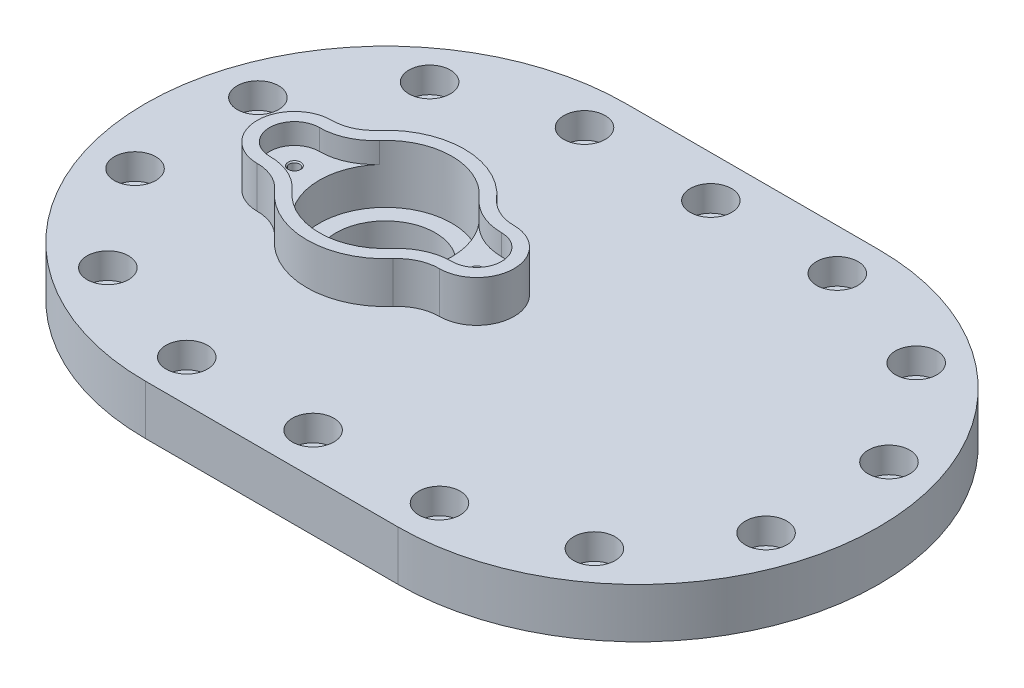
from build123d import *

# Parameters (mm, degrees)
SKETCH2_R                   = 5
BOSS_EXTRUDE4_DEPTH         = 12
SKETCH2_6_R                 = 16
SKETCH2_6_R_2               = 12
BOSS_EXTRUDE5_DEPTH         = 8
SKETCH2_7_R                 = 1.25
BOSS_EXTRUDE6_DEPTH         = 17
BOSS_EXTRUDE7_DEPTH         = 22
SKETCH2_10_R                = 1.25
BOSS_EXTRUDE9_DEPTH         = 17
M3_TAPPED_HOLE2_D           = 2.5
M3_TAPPED_HOLE2_DEPTH       = 10
M3_TAPPED_HOLE2_CSINK_D     = 3.05
M3_TAPPED_HOLE2_CSINK_ANGLE = 90
M3_TAPPED_HOLE2_TIP         = 0.751075774
SKETCH11_R                  = 12
CUT_EXTRUDE1_DEPTH          = 1
SKETCH12_R                  = 8
CUT_EXTRUDE2_DEPTH          = 6
CHAMFER1_SIZE               = 1
SKETCH2_12_R                = 5
SKETCH2_12_R_2              = 2.75
BOSS_EXTRUDE10_DEPTH        = 5.8


with BuildPart() as part:
    # Sketch2 → Boss-Extrude4 (new body)
    with BuildSketch(Plane(origin=(0, 0, 0), x_dir=(1, 0, 0), z_dir=(0, 1, 0))):
        with BuildLine():
            Line((-61, -58), (0, -58))
            ThreePointArc((0, -58), (58, 0), (0, 58))
            Line((0, 58), (-61, 58))
            ThreePointArc((-61, 58), (-119, 0), (-61, -58))
        make_face()
        with Locations(Location((0, 48, 0), (0, 0, 270))):
            Circle(SKETCH2_R, mode=Mode.SUBTRACT)
        with Locations(Location((-30.5, 48, 0), (0, 0, 270))):
            Circle(SKETCH2_R, mode=Mode.SUBTRACT)
        with Locations(Location((-61, 48, 0), (0, 0, 270))):
            Circle(SKETCH2_R, mode=Mode.SUBTRACT)
        with Locations(Location((-89.21369211, 38.83281573, 0), (0, 0, 270))):
            Circle(SKETCH2_R, mode=Mode.SUBTRACT)
        with Locations(Location((-106.650712782, 14.83281573, 0), (0, 0, 270))):
            Circle(SKETCH2_R, mode=Mode.SUBTRACT)
        with Locations(Location((-106.650712782, -14.83281573, 0), (0, 0, 270))):
            Circle(SKETCH2_R, mode=Mode.SUBTRACT)
        with Locations(Location((-89.21369211, -38.83281573, 0), (0, 0, 270))):
            Circle(SKETCH2_R, mode=Mode.SUBTRACT)
        with Locations(Location((-61, -48, 0), (0, 0, 270))):
            Circle(SKETCH2_R, mode=Mode.SUBTRACT)
        with Locations(Location((-30.5, -48, 0), (0, 0, 270))):
            Circle(SKETCH2_R, mode=Mode.SUBTRACT)
        with Locations(Location((0, -48, 0), (0, 0, 270))):
            Circle(SKETCH2_R, mode=Mode.SUBTRACT)
        with Locations(Location((28.21369211, -38.83281573, 0), (0, 0, 270))):
            Circle(SKETCH2_R, mode=Mode.SUBTRACT)
        with Locations(Location((45.650712782, -14.83281573, 0), (0, 0, 270))):
            Circle(SKETCH2_R, mode=Mode.SUBTRACT)
        with Locations(Location((45.650712782, 14.83281573, 0), (0, 0, 270))):
            Circle(SKETCH2_R, mode=Mode.SUBTRACT)
        with Locations(Location((28.21369211, 38.83281573, 0), (0, 0, 270))):
            Circle(SKETCH2_R, mode=Mode.SUBTRACT)
        with BuildLine():
            ThreePointArc((-75.315068493, -12.493150685), (-61, -19), (-46.684931507, -12.493150685))
            ThreePointArc((-46.684931507, -12.493150685), (-43.220790032, -9.91426193), (-39, -9))
            ThreePointArc((-39, -9), (-30, 0), (-39, 9))
            ThreePointArc((-39, 9), (-43.220790032, 9.91426193), (-46.684931507, 12.493150685))
            ThreePointArc((-46.684931507, 12.493150685), (-61, 19), (-75.315068493, 12.493150685))
            ThreePointArc((-75.315068493, 12.493150685), (-78.779209968, 9.91426193), (-83, 9))
            ThreePointArc((-83, 9), (-92, 0), (-83, -9))
            ThreePointArc((-83, -9), (-78.779209968, -9.91426193), (-75.315068493, -12.493150685))
        make_face(mode=Mode.SUBTRACT)
    extrude(amount=BOSS_EXTRUDE4_DEPTH)



with BuildPart() as body_2:
    # Sketch2<6> → Boss-Extrude5 (new body)
    with BuildSketch(Plane(origin=(0, 0, 0), x_dir=(1, 0, 0), z_dir=(0, 1, 0))):
        with Locations(Location((-61, 0, 0), (0, 0, 270))):
            Circle(SKETCH2_6_R)
        with Locations(Location((-61, 0, 0), (0, 0, 270))):
            Circle(SKETCH2_6_R_2, mode=Mode.SUBTRACT)
    extrude(amount=BOSS_EXTRUDE5_DEPTH)

    # Sketch2<7> → Boss-Extrude6 (add)
    # profile 1 of 2: a face of its own
    with BuildSketch(Plane(origin=(0, 0, 0), x_dir=(1, 0, 0), z_dir=(0, 1, 0))):
        with BuildLine():
            ThreePointArc((-48.945205479, 10.520547945), (-46.018733159, 5.617975065), (-45, 0))
            ThreePointArc((-45, 0), (-46.018733159, -5.617975065), (-48.945205479, -10.520547945))
            ThreePointArc((-48.945205479, -10.520547945), (-44.462198865, -7.183162497), (-39, -6))
            ThreePointArc((-39, -6), (-33, 0), (-39, 6))
            ThreePointArc((-39, 6), (-44.462198865, 7.183162497), (-48.945205479, 10.520547945))
        make_face()
        with Locations(Location((-39, 0, 0), (0, 0, 270))):
            Circle(SKETCH2_7_R, mode=Mode.SUBTRACT)
    # profile 2 of 2: a face of its own
    with BuildSketch(Plane(origin=(0, 0, 0), x_dir=(1, 0, 0), z_dir=(0, 1, 0))):
        with BuildLine():
            ThreePointArc((-73.054794521, -10.520547945), (-77, 0), (-73.054794521, 10.520547945))
            ThreePointArc((-73.054794521, 10.520547945), (-77.537801135, 7.183162497), (-83, 6))
            ThreePointArc((-83, 6), (-89, 0), (-83, -6))
            ThreePointArc((-83, -6), (-77.537801135, -7.183162497), (-73.054794521, -10.520547945))
        make_face()
        with Locations(Location((-83, 0, 0), (0, 0, 270))):
            Circle(SKETCH2_7_R, mode=Mode.SUBTRACT)
    extrude(amount=BOSS_EXTRUDE6_DEPTH)


with BuildPart() as part_1:
    add(part.part)

    add(body_2.part)  # Boss-Extrude7 merges body 2
    # Sketch2<8> → Boss-Extrude7 (add)
    with BuildSketch(Plane(origin=(0, 0, 0), x_dir=(1, 0, 0), z_dir=(0, 1, 0))):
        with BuildLine():
            ThreePointArc((-46.684931507, -12.493150685), (-43.220790032, -9.91426193), (-39, -9))
            ThreePointArc((-39, -9), (-30, 0), (-39, 9))
            ThreePointArc((-39, 9), (-43.220790032, 9.91426193), (-46.684931507, 12.493150685))
            ThreePointArc((-46.684931507, 12.493150685), (-61, 19), (-75.315068493, 12.493150685))
            ThreePointArc((-75.315068493, 12.493150685), (-78.779209968, 9.91426193), (-83, 9))
            ThreePointArc((-83, 9), (-92, 0), (-83, -9))
            ThreePointArc((-83, -9), (-78.779209968, -9.91426193), (-75.315068493, -12.493150685))
            ThreePointArc((-75.315068493, -12.493150685), (-61, -19), (-46.684931507, -12.493150685))
        make_face()
        with BuildLine():
            ThreePointArc((-48.945205479, 10.520547945), (-44.462198865, 7.183162497), (-39, 6))
            ThreePointArc((-39, 6), (-33, 0), (-39, -6))
            ThreePointArc((-39, -6), (-44.462198865, -7.183162497), (-48.945205479, -10.520547945))
            ThreePointArc((-48.945205479, -10.520547945), (-61, -16), (-73.054794521, -10.520547945))
            ThreePointArc((-73.054794521, -10.520547945), (-77.537801135, -7.183162497), (-83, -6))
            ThreePointArc((-83, -6), (-89, 0), (-83, 6))
            ThreePointArc((-83, 6), (-77.537801135, 7.183162497), (-73.054794521, 10.520547945))
            ThreePointArc((-73.054794521, 10.520547945), (-61, 16), (-48.945205479, 10.520547945))
        make_face(mode=Mode.SUBTRACT)
    extrude(amount=BOSS_EXTRUDE7_DEPTH)

    # Sketch2<10> → Boss-Extrude9 (add)
    with BuildSketch(Plane(origin=(0, 0, 0), x_dir=(1, 0, 0), z_dir=(0, 1, 0))):
        with Locations((-39, 0)):
            Circle(SKETCH2_10_R)
        with Locations((-83, 0)):
            Circle(SKETCH2_10_R)
    extrude(amount=BOSS_EXTRUDE9_DEPTH)

    # M3 Tapped Hole2
    with Locations(Plane(origin=(0, 17, 0), x_dir=(1, 0, 0), z_dir=(0, 1, 0))):
        with Locations((-39, 0), (-83, 0)):
            CounterSinkHole(M3_TAPPED_HOLE2_D / 2, M3_TAPPED_HOLE2_CSINK_D / 2, depth=M3_TAPPED_HOLE2_DEPTH, counter_sink_angle=M3_TAPPED_HOLE2_CSINK_ANGLE)
            with Locations((0, 0, -(M3_TAPPED_HOLE2_DEPTH + M3_TAPPED_HOLE2_TIP / 2))):  # 118° drill point
                Cone(0, M3_TAPPED_HOLE2_D / 2, M3_TAPPED_HOLE2_TIP, mode=Mode.SUBTRACT)

    # Sketch11 → Cut-Extrude1 (cut)
    with BuildSketch(Plane.XZ):
        with Locations(Location((0, 0, 0), (0, 0, 270))):
            Circle(SKETCH11_R)
    extrude(amount=-CUT_EXTRUDE1_DEPTH, mode=Mode.SUBTRACT)

    # Sketch12 → Cut-Extrude2 (cut)
    with BuildSketch(Plane.XZ):
        with Locations(Location((0, 0, 0), (0, 0, 270))):
            Circle(SKETCH12_R)
    extrude(amount=-CUT_EXTRUDE2_DEPTH, mode=Mode.SUBTRACT)

    # Chamfer1
    chamfer1_edges = [part_1.edges().sort_by_distance(p)[0] for p in [
        (0, 0, 12),
    ]]
    chamfer(chamfer1_edges, length=CHAMFER1_SIZE - 0.0001)  # a hair under: the kernel refuses the full size

    # Sketch2<12> → Boss-Extrude10 (add)
    # profile 1 of 14: a face of its own
    with BuildSketch(Plane(origin=(0, 0, 0), x_dir=(1, 0, 0), z_dir=(0, 1, 0))):
        with Locations(Location((0, -48, 0), (0, 0, 270))):
            Circle(SKETCH2_12_R)
        with Locations(Location((0, -48, 0), (0, 0, 270))):
            Circle(SKETCH2_12_R_2, mode=Mode.SUBTRACT)
    # profile 2 of 14: a face of its own
    with BuildSketch(Plane(origin=(0, 0, 0), x_dir=(1, 0, 0), z_dir=(0, 1, 0))):
        with Locations(Location((28.21369211, -38.83281573, 0), (0, 0, 270))):
            Circle(SKETCH2_12_R)
        with Locations(Location((28.21369211, -38.83281573, 0), (0, 0, 270))):
            Circle(SKETCH2_12_R_2, mode=Mode.SUBTRACT)
    # profile 3 of 14: a face of its own
    with BuildSketch(Plane(origin=(0, 0, 0), x_dir=(1, 0, 0), z_dir=(0, 1, 0))):
        with Locations(Location((45.650712782, -14.83281573, 0), (0, 0, 270))):
            Circle(SKETCH2_12_R)
        with Locations(Location((45.650712782, -14.83281573, 0), (0, 0, 270))):
            Circle(SKETCH2_12_R_2, mode=Mode.SUBTRACT)
    # profile 4 of 14: a face of its own
    with BuildSketch(Plane(origin=(0, 0, 0), x_dir=(1, 0, 0), z_dir=(0, 1, 0))):
        with Locations(Location((45.650712782, 14.83281573, 0), (0, 0, 270))):
            Circle(SKETCH2_12_R)
        with Locations(Location((45.650712782, 14.83281573, 0), (0, 0, 270))):
            Circle(SKETCH2_12_R_2, mode=Mode.SUBTRACT)
    # profile 5 of 14: a face of its own
    with BuildSketch(Plane(origin=(0, 0, 0), x_dir=(1, 0, 0), z_dir=(0, 1, 0))):
        with Locations(Location((28.21369211, 38.83281573, 0), (0, 0, 270))):
            Circle(SKETCH2_12_R)
        with Locations(Location((28.21369211, 38.83281573, 0), (0, 0, 270))):
            Circle(SKETCH2_12_R_2, mode=Mode.SUBTRACT)
    # profile 6 of 14: a face of its own
    with BuildSketch(Plane(origin=(0, 0, 0), x_dir=(1, 0, 0), z_dir=(0, 1, 0))):
        with Locations(Location((0, 48, 0), (0, 0, 270))):
            Circle(SKETCH2_12_R)
        with Locations(Location((0, 48, 0), (0, 0, 270))):
            Circle(SKETCH2_12_R_2, mode=Mode.SUBTRACT)
    # profile 7 of 14: a face of its own
    with BuildSketch(Plane(origin=(0, 0, 0), x_dir=(1, 0, 0), z_dir=(0, 1, 0))):
        with Locations(Location((-30.5, 48, 0), (0, 0, 270))):
            Circle(SKETCH2_12_R)
        with Locations(Location((-30.5, 48, 0), (0, 0, 270))):
            Circle(SKETCH2_12_R_2, mode=Mode.SUBTRACT)
    # profile 8 of 14: a face of its own
    with BuildSketch(Plane(origin=(0, 0, 0), x_dir=(1, 0, 0), z_dir=(0, 1, 0))):
        with Locations(Location((-61, 48, 0), (0, 0, 270))):
            Circle(SKETCH2_12_R)
        with Locations(Location((-61, 48, 0), (0, 0, 270))):
            Circle(SKETCH2_12_R_2, mode=Mode.SUBTRACT)
    # profile 9 of 14: a face of its own
    with BuildSketch(Plane(origin=(0, 0, 0), x_dir=(1, 0, 0), z_dir=(0, 1, 0))):
        with Locations(Location((-89.21369211, 38.83281573, 0), (0, 0, 270))):
            Circle(SKETCH2_12_R)
        with Locations(Location((-89.21369211, 38.83281573, 0), (0, 0, 270))):
            Circle(SKETCH2_12_R_2, mode=Mode.SUBTRACT)
    # profile 10 of 14: a face of its own
    with BuildSketch(Plane(origin=(0, 0, 0), x_dir=(1, 0, 0), z_dir=(0, 1, 0))):
        with Locations(Location((-106.650712782, 14.83281573, 0), (0, 0, 270))):
            Circle(SKETCH2_12_R)
        with Locations(Location((-106.650712782, 14.83281573, 0), (0, 0, 270))):
            Circle(SKETCH2_12_R_2, mode=Mode.SUBTRACT)
    # profile 11 of 14: a face of its own
    with BuildSketch(Plane(origin=(0, 0, 0), x_dir=(1, 0, 0), z_dir=(0, 1, 0))):
        with Locations(Location((-106.650712782, -14.83281573, 0), (0, 0, 270))):
            Circle(SKETCH2_12_R)
        with Locations(Location((-106.650712782, -14.83281573, 0), (0, 0, 270))):
            Circle(SKETCH2_12_R_2, mode=Mode.SUBTRACT)
    # profile 12 of 14: a face of its own
    with BuildSketch(Plane(origin=(0, 0, 0), x_dir=(1, 0, 0), z_dir=(0, 1, 0))):
        with Locations(Location((-89.21369211, -38.83281573, 0), (0, 0, 270))):
            Circle(SKETCH2_12_R)
        with Locations(Location((-89.21369211, -38.83281573, 0), (0, 0, 270))):
            Circle(SKETCH2_12_R_2, mode=Mode.SUBTRACT)
    # profile 13 of 14: a face of its own
    with BuildSketch(Plane(origin=(0, 0, 0), x_dir=(1, 0, 0), z_dir=(0, 1, 0))):
        with Locations(Location((-61, -48, 0), (0, 0, 270))):
            Circle(SKETCH2_12_R)
        with Locations(Location((-61, -48, 0), (0, 0, 270))):
            Circle(SKETCH2_12_R_2, mode=Mode.SUBTRACT)
    # profile 14 of 14: a face of its own
    with BuildSketch(Plane(origin=(0, 0, 0), x_dir=(1, 0, 0), z_dir=(0, 1, 0))):
        with Locations(Location((-30.5, -48, 0), (0, 0, 270))):
            Circle(SKETCH2_12_R)
        with Locations(Location((-30.5, -48, 0), (0, 0, 270))):
            Circle(SKETCH2_12_R_2, mode=Mode.SUBTRACT)
    extrude(amount=BOSS_EXTRUDE10_DEPTH)


solid = part_1.part
